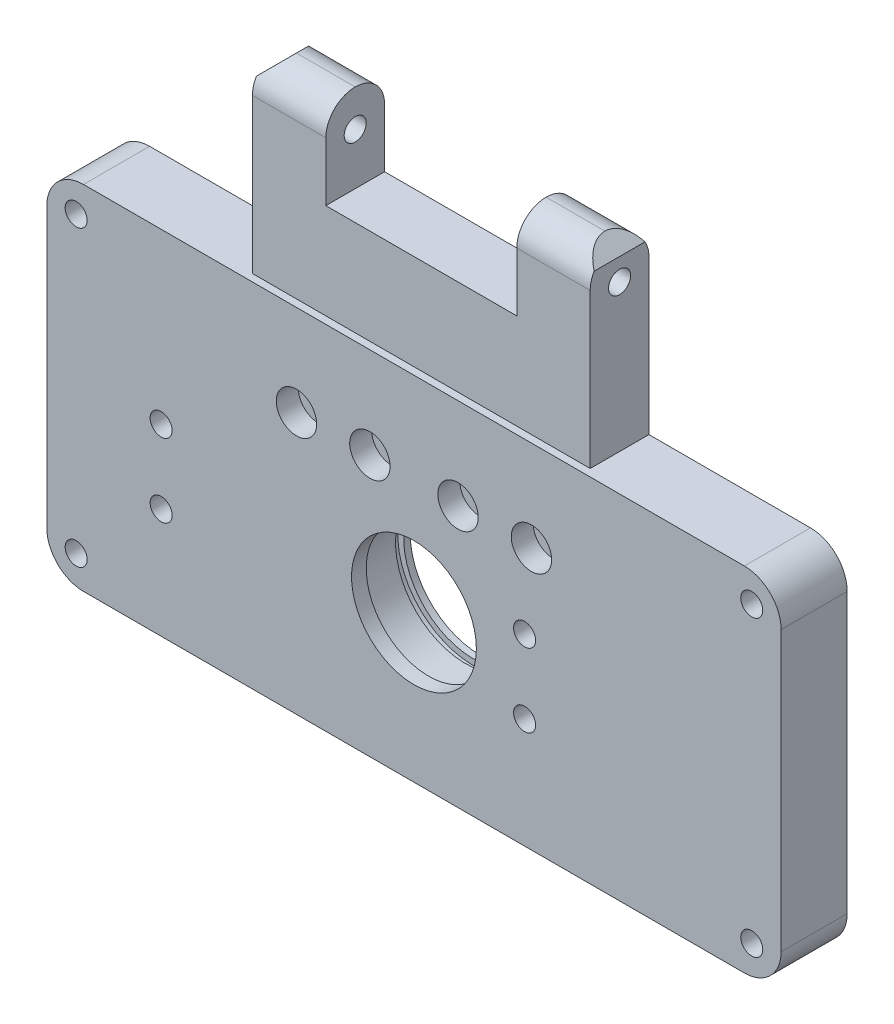
from build123d import *

# Parameters (mm, degrees)
SKETCH_2_W                = 100
SKETCH_2_H                = 40
EXTRUDE_1_DEPTH           = 6
SKETCH_5_W                = 100
SKETCH_5_H                = 40
EXTRUDE_2_DEPTH           = 3
SKETCH_6_R                = 9.5
CUT_EXTRUDE_1_DEPTH       = 7
CUT_EXTRUDE_START         = -8
SKETCH_7_R                = 9.5
CUT_EXTRUDE_2_DEPTH       = 8
SKETCH_8_R                = 10.3
CUT_EXTRUDE_3_DEPTH       = 1.1
SKETCH_9_R                = 1.5
CUT_EXTRUDE_4_DEPTH       = 15
SKETCH_11_W               = 100
SKETCH_11_H               = 9
EXTRUDE_5_DEPTH           = 8
FILLET_3_R                = 5
SKETCH_16_R               = 1.5
CUT_EXTRUDE_6_DEPTH       = 10
HOLE_WIZARD_5_D           = 3
HOLE_WIZARD_5_CBORE_D     = 5.5
HOLE_WIZARD_5_CBORE_DEPTH = 3
SKETCH_20_R               = 1.5
CUT_EXTRUDE_7_DEPTH       = 10
SKETCH_22_R               = 9.5
SKETCH_22_R_2             = 8.5
EXTRUDE_6_DEPTH           = 2
SKETCH_23_W               = 46
SKETCH_23_H               = 8
EXTRUDE_7_DEPTH           = 25
SKETCH_24_W               = 13
SKETCH_24_H               = 8
CUT_EXTRUDE_8_DEPTH       = 12
CHAMFER_1_SIZE            = 2
FILLET_4_R                = 4
SKETCH_25_R               = 1.5
CUT_EXTRUDE_9_DEPTH       = 91.65870063


with BuildPart() as part:
    # 草图2 → 凸台-拉伸1 (new body)
    with BuildSketch(Plane.XY):
        Rectangle(SKETCH_2_W, SKETCH_2_H)
    extrude(amount=EXTRUDE_1_DEPTH)

    # 草图5 → 凸台-拉伸2 (add)
    with BuildSketch(Plane.XY.offset(6)):
        Rectangle(SKETCH_5_W, SKETCH_5_H)
    extrude(amount=EXTRUDE_2_DEPTH)

    # 草图6 → 切除-拉伸1 (cut)
    with BuildSketch(Plane.XY.offset(9)):
        Circle(SKETCH_6_R)
    extrude(amount=-CUT_EXTRUDE_1_DEPTH, mode=Mode.SUBTRACT)

    # 草图7 → 切除-拉伸2 (cut)
    with BuildSketch(Plane(origin=(0, 0, 0), x_dir=(-1, 0, 0), z_dir=(0, 0, -1)).offset(CUT_EXTRUDE_START)):
        with Locations(Location((0, 0, 0), (0, 0, 180))):
            Circle(SKETCH_7_R)
    extrude(amount=CUT_EXTRUDE_2_DEPTH, mode=Mode.SUBTRACT)

    # 草图8 → 切除-拉伸3 (cut)
    with BuildSketch(Plane.XY.offset(2)):
        Circle(SKETCH_8_R)
    extrude(amount=-CUT_EXTRUDE_3_DEPTH, mode=Mode.SUBTRACT)

    # 草图9 → 切除-拉伸4 (cut)
    with BuildSketch(Plane(origin=(0, 0, 0), x_dir=(-1, 0, 0), z_dir=(0, 0, -1))):
        with Locations((-15.07, 5)):
            Circle(SKETCH_9_R)
        with Locations((34.43, 5)):
            Circle(SKETCH_9_R)
        with Locations((-15.07, -5)):
            Circle(SKETCH_9_R)
        with Locations((34.43, -5)):
            Circle(SKETCH_9_R)
    extrude(amount=-CUT_EXTRUDE_4_DEPTH, mode=Mode.SUBTRACT)

    # 草图11 → 凸台-拉伸5 (add)
    with BuildSketch(Plane(origin=(0, 20, 0), x_dir=(1, 0, 0), z_dir=(0, 1, 0))):
        with Locations((0, -4.5)):
            Rectangle(SKETCH_11_W, SKETCH_11_H)
    extrude(amount=EXTRUDE_5_DEPTH)

    # 圆角3
    fillet_3_edges = [part.edges().sort_by_distance(p)[0] for p in [
        (-50, 28, 4.5),
        (50, 28, 4.5),
        (50, -20, 4.5),
        (-50, -20, 4.5),
    ]]
    fillet(fillet_3_edges, radius=FILLET_3_R)

    # 草图16 → 切除-拉伸6 (cut)
    with BuildSketch(Plane(origin=(0, 0, 0), x_dir=(-1, 0, 0), z_dir=(0, 0, -1))):
        with Locations((-6, 15.6)):
            Circle(SKETCH_16_R)
        with Locations((6, 15.6)):
            Circle(SKETCH_16_R)
        with Locations((-16, 15.6)):
            Circle(SKETCH_16_R)
        with Locations((16, 15.6)):
            Circle(SKETCH_16_R)
    extrude(amount=-CUT_EXTRUDE_6_DEPTH, mode=Mode.SUBTRACT)

    # 孔5 (through all)
    with Locations(Plane(origin=(-16, 15.6, 9), x_dir=(1, 0, 0), z_dir=(0, 0, 1))):
        with Locations((0, 0), (10, 0), (22, 0), (32, 0)):
            CounterBoreHole(HOLE_WIZARD_5_D / 2, HOLE_WIZARD_5_CBORE_D / 2, HOLE_WIZARD_5_CBORE_DEPTH)

    # 草图20 → 切除-拉伸7 (cut)
    with BuildSketch(Plane(origin=(0, 0, 0), x_dir=(-1, 0, 0), z_dir=(0, 0, -1))):
        with Locations((-46, 24)):
            Circle(SKETCH_20_R)
        with Locations((46, 24)):
            Circle(SKETCH_20_R)
        with Locations((-46, -16)):
            Circle(SKETCH_20_R)
        with Locations((46, -16)):
            Circle(SKETCH_20_R)
    extrude(amount=-CUT_EXTRUDE_7_DEPTH, mode=Mode.SUBTRACT)

    # 草图22 → 凸台-拉伸6 (add)
    with BuildSketch(Plane.XY.offset(9)):
        Circle(SKETCH_22_R)
        Circle(SKETCH_22_R_2, mode=Mode.SUBTRACT)
    extrude(amount=-EXTRUDE_6_DEPTH)

    # 草图23 → 凸台-拉伸7 (add)
    with BuildSketch(Plane(origin=(0, 28, 0), x_dir=(1, 0, 0), z_dir=(0, 1, 0))):
        with Locations((0, -4)):
            Rectangle(SKETCH_23_W, SKETCH_23_H)
    extrude(amount=EXTRUDE_7_DEPTH)

    # 草图24 → 切除-拉伸8 (cut)
    with BuildSketch(Plane(origin=(0, 53, 0), x_dir=(1, 0, 0), z_dir=(0, 1, 0))):
        with Locations((-6.5, -4)):
            Rectangle(SKETCH_24_W, SKETCH_24_H)
        with Locations((6.5, -4)):
            Rectangle(SKETCH_24_W, SKETCH_24_H)
    extrude(amount=-CUT_EXTRUDE_8_DEPTH, mode=Mode.SUBTRACT)

    # 倒角1
    chamfer_1_edges = [part.edges().sort_by_distance(p)[0] for p in [
        (-23, 53, 4),
        (23, 53, 4),
    ]]
    chamfer(chamfer_1_edges, length=CHAMFER_1_SIZE)

    # 圆角4
    fillet_4_edges = [part.edges().sort_by_distance(p)[0] for p in [
        (17, 53, 8),
        (17, 53, 0),
        (-17, 53, 8),
        (-17, 53, 0),
    ]]
    fillet(fillet_4_edges, radius=FILLET_4_R - 0.0001)  # a hair under: the kernel refuses the full size

    # 草图25 → 切除-拉伸9 (cut, through all)
    with BuildSketch(Plane(origin=(23, 0, 0), x_dir=(0, 0, -1), z_dir=(1, 0, 0))):
        with Locations((-4, 48)):
            Circle(SKETCH_25_R)
    extrude(amount=-CUT_EXTRUDE_9_DEPTH, mode=Mode.SUBTRACT)


solid = part.part
